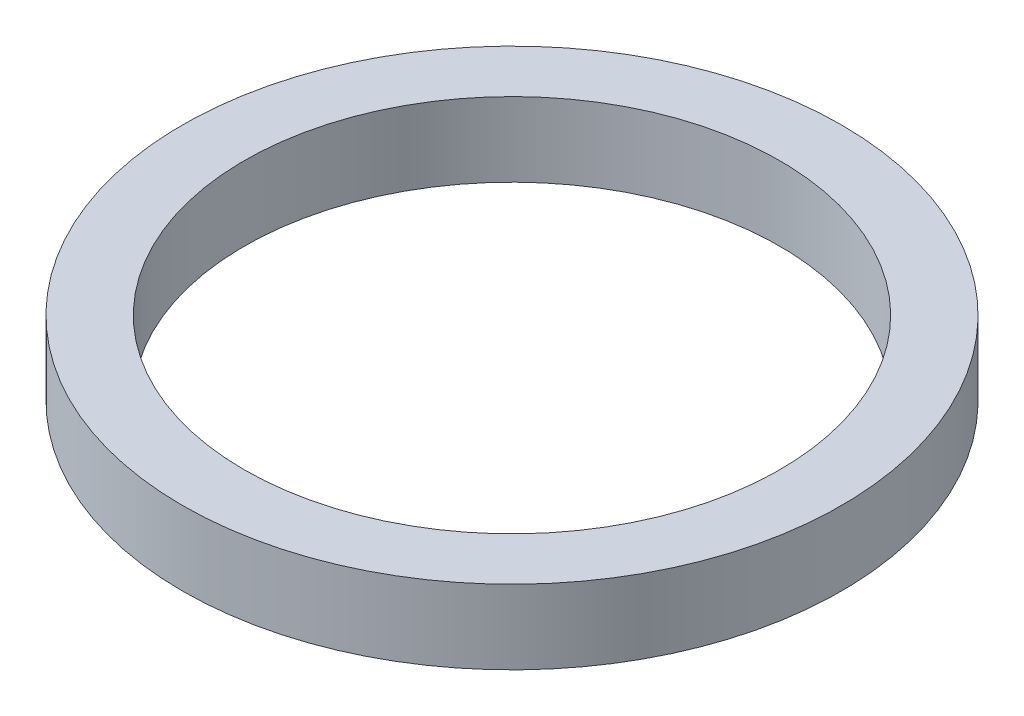
from build123d import *

# Parameters (mm, degrees)
SKETCH1_R           = 40
BOSS_EXTRUDE1_DEPTH = 9
SKETCH2_R           = 32.5
CUT_EXTRUDE1_DEPTH  = 58.280013966


with BuildPart() as part:
    # Sketch1 → Boss-Extrude1 (new body)
    with BuildSketch(Plane(origin=(0, 0, 0), x_dir=(1, 0, 0), z_dir=(0, 1, 0))):
        Circle(SKETCH1_R)
    extrude(amount=BOSS_EXTRUDE1_DEPTH)

    # Sketch2 → Cut-Extrude1 (cut, through all)
    with BuildSketch(Plane(origin=(0, 0, 0), x_dir=(1, 0, 0), z_dir=(0, 1, 0))):
        Circle(SKETCH2_R)
    extrude(amount=CUT_EXTRUDE1_DEPTH, mode=Mode.SUBTRACT)


solid = part.part
